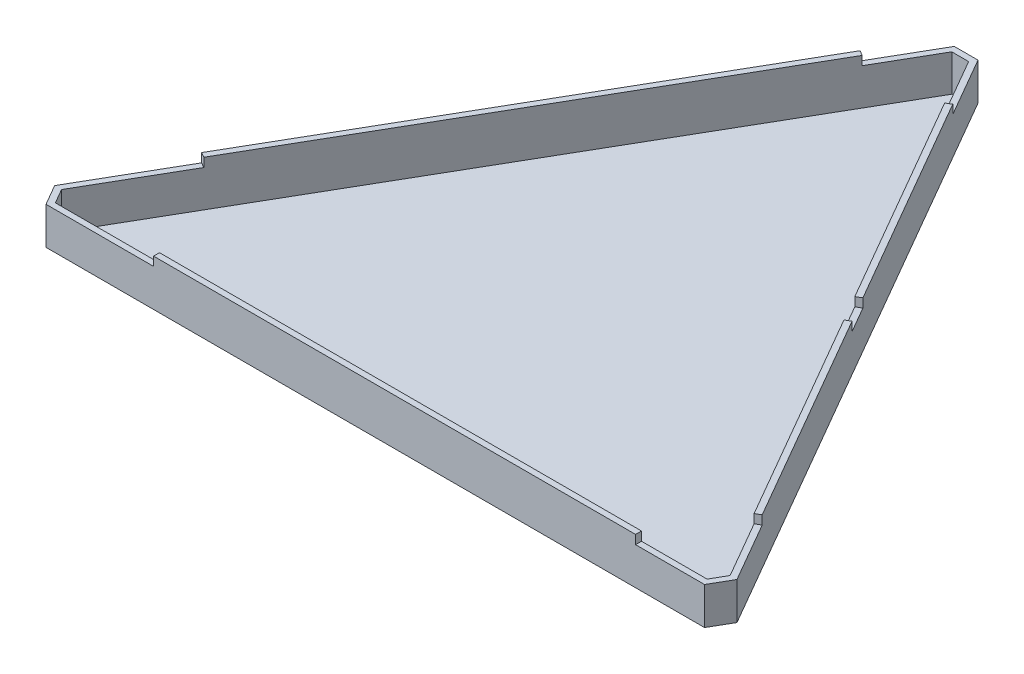
from build123d import *

# Parameters (mm, degrees)
BOSS_EXTRUDE1_DEPTH = 0.2
BOSS_EXTRUDE2_DEPTH = 12.58
SKETCH1_4_W         = 162.49
SKETCH1_4_H         = 2
BOSS_EXTRUDE3_DEPTH = 15.58


# Read off the part's stored shape, not the designer's step: Boss-Extrude2
with BuildPart() as part:
    # Sketch1 → Boss-Extrude1 (new body)
    with BuildSketch(Plane(origin=(0, 0, 0), x_dir=(1, 0, 0), z_dir=(0, 1, 0))):
        Polygon((-115, 0), (-111, -6.92820323), (111, -6.92820323), (115, 0), (15.625, 172.122549002), (13.892949192, 171.122549002), (2.845299462, 190.25763964), (-2.845299462, 190.25763964), (-13.892949192, 171.122549002), (-15.625, 172.122549002), align=None)
    extrude(amount=BOSS_EXTRUDE1_DEPTH)

    # Boss-Extrude2 outline → Boss-Extrude2 (add)
    with BuildSketch(Plane(origin=(0, 0, 0), x_dir=(1, 0, 0), z_dir=(0, 1, 0))):
        Polygon((15.625, 172.122549002), (4, 192.25763964), (-4, 192.25763964), (-15.625, 172.122549002), (-13.892949192, 171.122549002), (-2.845299462, 190.25763964), (2.845299462, 190.25763964), (13.892949192, 171.122549002), align=None)
        Polygon((62, 91.798692801), (57, 100.458946839), (55.267949192, 99.458946839), (60.267949192, 90.798692801), align=None)
        Polygon((-95.137949192, 30.402081141), (-96.87, 31.402081141), (-115, 0), (-111, -6.92820323), (-74.74, -6.92820323), (-74.74, -4.92820323), (-109.845299462, -4.92820323), (-112.690598923, 0), align=None)
        Polygon((115, 0), (103.375, 20.135090638), (101.642949192, 19.135090638), (112.690598923, 0), (109.845299462, -4.92820323), (87.75, -4.92820323), (87.75, -6.92820323), (111, -6.92820323), align=None)
    extrude(amount=BOSS_EXTRUDE2_DEPTH)

    # Sketch1<4> → Boss-Extrude3 (add)
    with BuildSketch(Plane(origin=(0, 0, 0), x_dir=(1, 0, 0), z_dir=(0, 1, 0))):
        Polygon((-15.625, 172.122549002), (-96.87, 31.402081141), (-95.137949192, 30.402081141), (-13.892949192, 171.122549002), align=None)
        with Locations((6.505, -5.92820323)):
            Rectangle(SKETCH1_4_W, SKETCH1_4_H)
        Polygon((57, 100.458946839), (15.625, 172.122549002), (13.892949192, 171.122549002), (55.267949192, 99.458946839), align=None)
        Polygon((101.642949192, 19.135090638), (103.375, 20.135090638), (62, 91.798692801), (60.267949192, 90.798692801), align=None)
    extrude(amount=BOSS_EXTRUDE3_DEPTH)


solid = part.part
